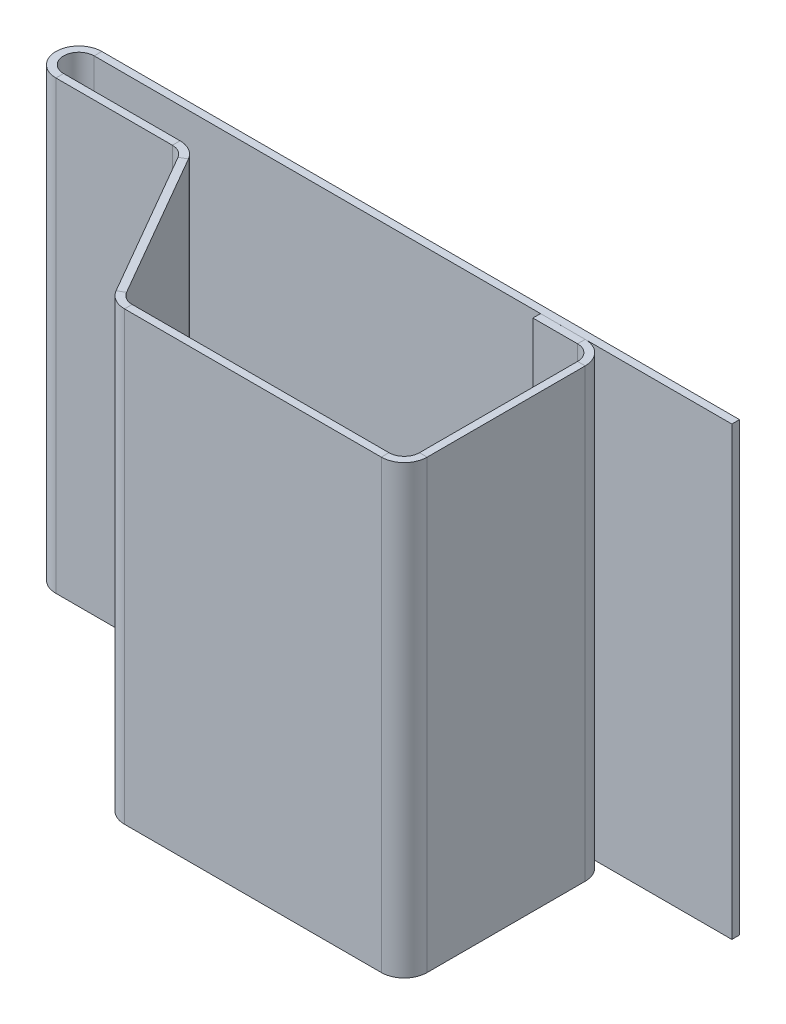
from build123d import *

# Parameters (mm, degrees)
SKETCH2_W = 70
SKETCH2_H = 1.2


with BuildPart() as part:
    # Sweep1: sweep along a path in Sketch4
    with BuildLine(Plane(origin=(0, 0, 0), x_dir=(-1, 0, 0), z_dir=(0, 1, 0))) as sweep1_path:
        Line((0, 0), (100, 0))
        ThreePointArc((100, 0), (103, 3), (100, 6))
        Line((100, 6), (81.732050808, 6))
        ThreePointArc((81.732050808, 6), (80.232050808, 6.401923789), (79.133974596, 7.5))
        Line((79.133974596, 7.5), (65.866025404, 30.480762114))
        ThreePointArc((65.866025404, 30.480762114), (64.767949192, 31.578838325), (63.267949192, 31.980762114))
        Line((63.267949192, 31.980762114), (23, 31.980762114))
        ThreePointArc((23, 31.980762114), (20.878679656, 31.102082457), (20, 28.980762114))
        Line((20, 28.980762114), (20, 4.200762114))
        ThreePointArc((20, 4.200762114), (20.878679656, 2.07944177), (23, 1.200762114))
        Line((23, 1.200762114), (30, 1.200762114))
    # Sketch2 → Sweep1 (sweep)
    with BuildSketch(Plane.YZ):
        Rectangle(SKETCH2_W, SKETCH2_H)
    sweep(path=sweep1_path.line)


solid = part.part
